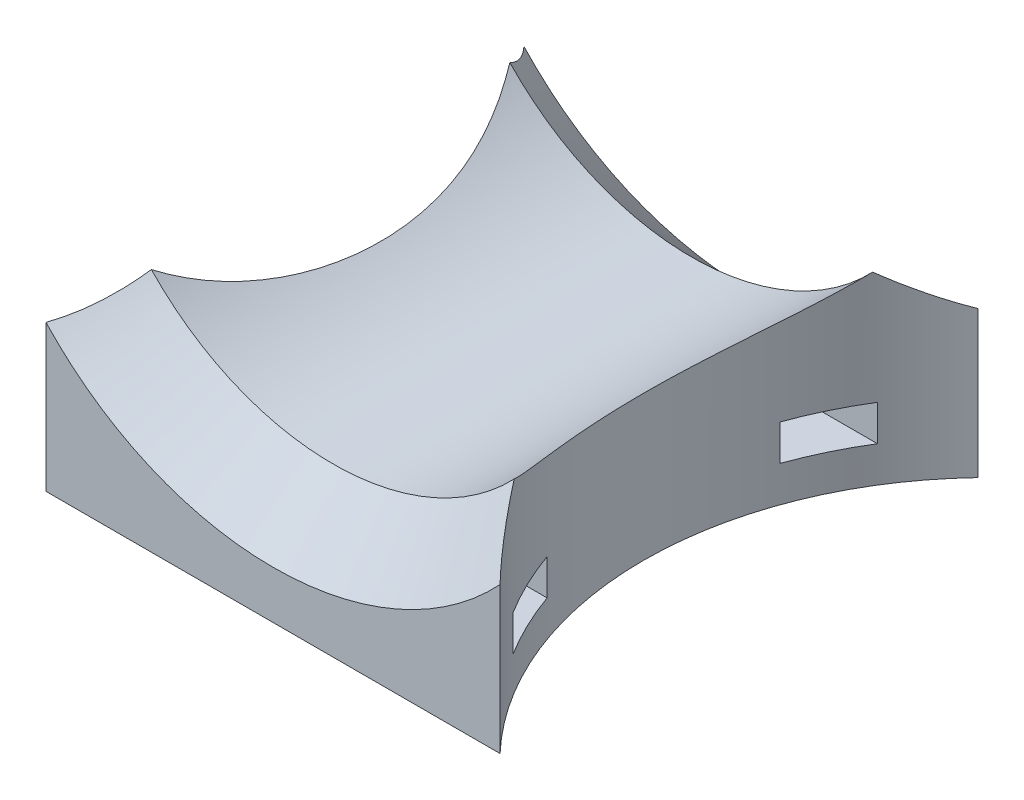
from build123d import *

# Parameters (mm, degrees)
BOSS_EXTRUDE1_DEPTH                 = 20
SKETCH4_R                           = 29
CUT_EXTRUDE1_DEPTH                  = 46.345892868
CHAMFER1_SIZE                       = 5
SKETCH5_W                           = 5.5
SKETCH5_H                           = 3
CUT_EXTRUDE2_DEPTH                  = 3
CUT_EXTRUDE2_DIRECTION_2_REACH      = 42.755
CUT_EXTRUDE2_DIRECTION_2_END_RADIUS = 29
SKETCH7_R                           = 1.8
CUT_EXTRUDE3_DEPTH                  = 6


with BuildPart() as part:
    # Sketch3 → Boss-Extrude1 (new, symmetric)
    with BuildSketch(Plane.XY):
        with BuildLine():
            Line((-27.5, -30), (27.5, -30))
            Line((27.5, -30), (27.5, 0))
            Line((27.5, 0), (21, 0))
            ThreePointArc((21, 0), (0, -21), (-21, 0))
            Line((-21, 0), (-27.5, 0))
            Line((-27.5, 0), (-27.5, -30))
        make_face()
    extrude(amount=BOSS_EXTRUDE1_DEPTH, both=True)

    # Sketch4 → Cut-Extrude1 (cut, through all)
    with BuildSketch(Plane(origin=(0, 0, 0), x_dir=(1, 0, 0), z_dir=(0, 1, 0))):
        with Locations((-40, 0)):
            Circle(SKETCH4_R)
        with Locations((40, 0)):
            Circle(SKETCH4_R)
    extrude(amount=-CUT_EXTRUDE1_DEPTH, mode=Mode.SUBTRACT)

    # Chamfer1
    # the kernel refuses this chamfer: 5 mm, written as the material it takes off along each edge
    with BuildSketch(Plane(origin=(0, 0, 20), x_dir=(0.9851003883005318, 0.1719803040180515, 0), z_dir=(-0.1719803040180515, 0.9851003883005318, 0))) as chamfer1_piece_1:
        Polygon((21 + CHAMFER1_SIZE, 0), (21, CHAMFER1_SIZE), (21, 0), align=None)
    revolve(axis=Axis((0, 0, 20), (0, 0, -1)), revolution_arc=199.805956235, mode=Mode.SUBTRACT)
    with BuildSketch(Plane(origin=(0, 0, -20), x_dir=(0.9851003883005321, 0.1719803040180491, 0), z_dir=(-0.1719803040180491, 0.9851003883005321, 0))) as chamfer1_piece_2:
        Polygon((21 + CHAMFER1_SIZE, 0), (21, -CHAMFER1_SIZE), (21, 0), align=None)
    revolve(axis=Axis((0, 0, -20), (0, 0, -1)), revolution_arc=199.805956235, mode=Mode.SUBTRACT)

    # Sketch5 → Cut-Extrude2 (cut)
    with BuildSketch(Plane(origin=(0, 0, 0), x_dir=(0, 0, -1), z_dir=(1, 0, 0))):
        with Locations((-12.5, -25.5)):
            Rectangle(SKETCH5_W, SKETCH5_H)
        with Locations((12.5, -25.5)):
            Rectangle(SKETCH5_W, SKETCH5_H)
    extrude(amount=-CUT_EXTRUDE2_DEPTH, mode=Mode.SUBTRACT)

    # Cut-Extrude2 direction 2: up to this cylinder (the profile starts outside it)
    cut_extrude2_direction_2_end = Plane(origin=(40, -25.5, 0), z_dir=(0, 1, 0)) * Cylinder(CUT_EXTRUDE2_DIRECTION_2_END_RADIUS, 144.51, mode=Mode.PRIVATE)
    # Sketch5 → Cut-Extrude2 direction 2 (cut, up to the surface)
    with BuildSketch(Plane(origin=(0, 0, 0), x_dir=(0, 0, -1), z_dir=(1, 0, 0)), mode=Mode.PRIVATE) as cut_extrude2_direction_2_sk1:
        with Locations((-12.5, -25.5)):
            Rectangle(SKETCH5_W, SKETCH5_H)
    cut_extrude2_direction_2_tool1 = extrude(cut_extrude2_direction_2_sk1.sketch, amount=CUT_EXTRUDE2_DIRECTION_2_REACH, mode=Mode.PRIVATE) - cut_extrude2_direction_2_end
    add(cut_extrude2_direction_2_tool1.solids().sort_by_distance((0, -25.5, 12.5))[0], mode=Mode.SUBTRACT)
    # Sketch5 → Cut-Extrude2 direction 2 (cut, up to the surface)
    with BuildSketch(Plane(origin=(0, 0, 0), x_dir=(0, 0, -1), z_dir=(1, 0, 0)), mode=Mode.PRIVATE) as cut_extrude2_direction_2_sk2:
        with Locations((12.5, -25.5)):
            Rectangle(SKETCH5_W, SKETCH5_H)
    cut_extrude2_direction_2_tool2 = extrude(cut_extrude2_direction_2_sk2.sketch, amount=CUT_EXTRUDE2_DIRECTION_2_REACH, mode=Mode.PRIVATE) - cut_extrude2_direction_2_end
    add(cut_extrude2_direction_2_tool2.solids().sort_by_distance((0, -25.5, -12.5))[0], mode=Mode.SUBTRACT)

    # Sketch7 → Cut-Extrude3 (cut)
    with BuildSketch(Plane.XZ.offset(30)):
        with Locations(Location((0, 12.5, 0), (0, 0, 270))):
            Circle(SKETCH7_R)
        with Locations(Location((0, -12.5, 0), (0, 0, 90))):
            Circle(SKETCH7_R)
    extrude(amount=-CUT_EXTRUDE3_DEPTH, mode=Mode.SUBTRACT)


solid = part.part
